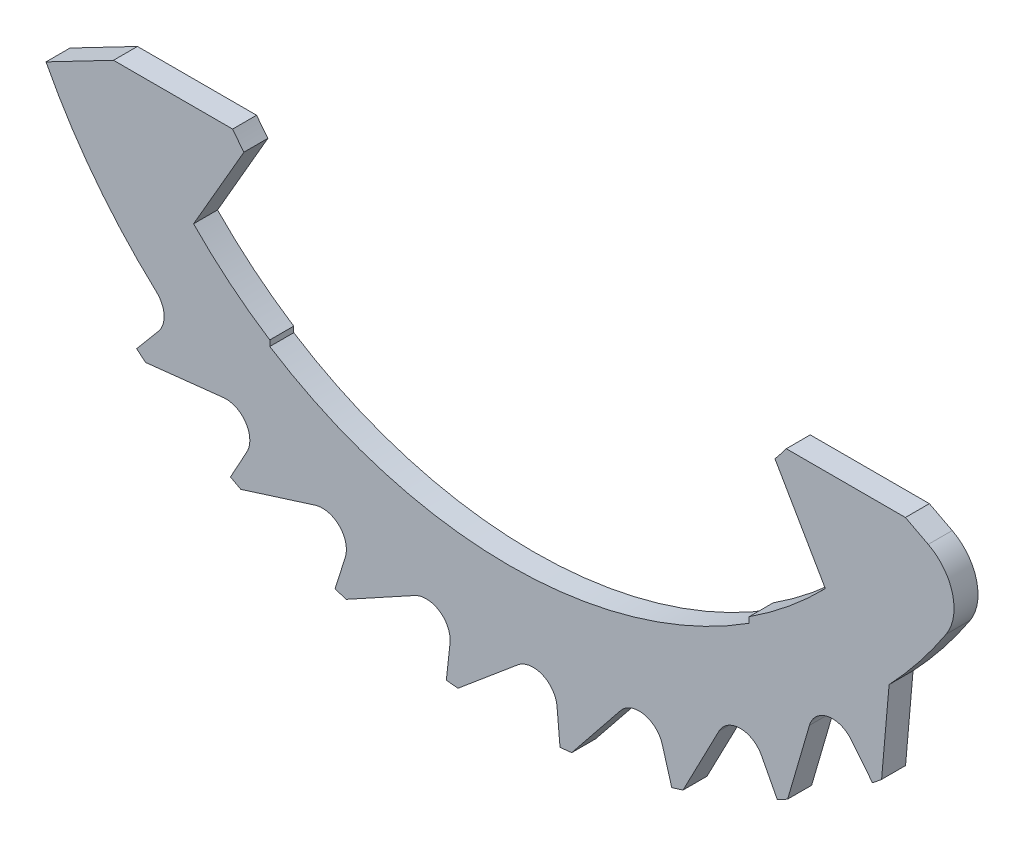
from build123d import *

# Parameters (mm, degrees)
OTHER_10076_5_DEPTH = 0.5
CUT_EXTRUDE1_START  = -0.5
CUT_EXTRUDE1_DEPTH  = 0.5


# Read off the part's stored shape, not the designer's step: 10076-5
with BuildPart() as part:
    # Other 10076-5 outline → Other 10076-5 (new body)
    with BuildSketch(Plane.XY):
        with BuildLine():
            ThreePointArc((7.573674013, -9.436602245), (7.668819519, -9.359444812), (7.763179028, -9.281328104))
            Line((7.763179028, -9.281328104), (7.919995926, -7.488902759))
            ThreePointArc((7.919995926, -7.488902759), (8.548470738, -6.76266575), (9.110578105, -5.983925684))
            ThreePointArc((9.110578105, -5.983925684), (9.242448569, -5.182849851), (8.736493865, -4.547930843))
            Line((8.736493865, -4.547930843), (8.260223146, -4.3))
            Line((8.260223146, -4.3), (5.774945887, -4.3))
            ThreePointArc((5.774945887, -4.3), (5.659072475, -4.451392897), (5.53923133, -4.5996648))
            Line((5.53923133, -4.5996648), (6.59, -6.419649523))
            ThreePointArc((6.59, -6.419649523), (5.831509763, -7.1157216), (5, -7.722693831))
            Line((5, -7.722693831), (5, -7.841555968))
            ThreePointArc((5, -7.841555968), (0, -9.3), (-5, -7.841555968))
            Line((-5, -7.841555968), (-5, -7.722693831))
            ThreePointArc((-5, -7.722693831), (-5.831509763, -7.1157216), (-6.59, -6.419649523))
            Line((-6.59, -6.419649523), (-5.53923133, -4.5996648))
            ThreePointArc((-5.53923133, -4.5996648), (-5.659072475, -4.451392897), (-5.774945887, -4.3))
            Line((-5.774945887, -4.3), (-8.260223146, -4.3))
            Line((-8.260223146, -4.3), (-10.732831081, -5.58715822))
            ThreePointArc((-10.732831081, -5.58715822), (-10.675718173, -5.6955282), (-10.617511084, -5.803314431))
            Line((-10.617511084, -5.803314431), (-9.055174855, -6.258693914))
            ThreePointArc((-9.055174855, -6.258693914), (-8.704696722, -6.64117368), (-8.882127626, -7.128661083))
            Line((-8.882127626, -7.128661083), (-9.436602245, -7.573674013))
            ThreePointArc((-9.436602245, -7.573674013), (-9.359444812, -7.668819519), (-9.281328104, -7.763179028))
            Line((-9.281328104, -7.763179028), (-7.660171598, -7.905011844))
            ThreePointArc((-7.660171598, -7.905011844), (-7.241809703, -8.211767477), (-7.320727248, -8.724502998))
            Line((-7.320727248, -8.724502998), (-7.777730077, -9.269137762))
            ThreePointArc((-7.777730077, -9.269137762), (-7.683493234, -9.347402405), (-7.588468891, -9.424709008))
            Line((-7.588468891, -9.424709008), (-5.970792243, -9.247544602))
            ThreePointArc((-5.970792243, -9.247544602), (-5.500623999, -9.466787654), (-5.477995427, -9.985067155))
            Line((-5.477995427, -9.985067155), (-5.819964104, -10.608393744))
            ThreePointArc((-5.819964104, -10.608393744), (-5.712269322, -10.666769858), (-5.603989074, -10.724052707))
            Line((-5.603989074, -10.724052707), (-4.05195869, -10.234699407))
            ThreePointArc((-4.05195869, -10.234699407), (-3.548052399, -10.358004491), (-3.424747314, -10.861910782))
            Line((-3.424747314, -10.861910782), (-3.638540174, -11.539975104))
            ThreePointArc((-3.638540174, -11.539975104), (-3.521526102, -11.576219327), (-3.404151099, -11.611277074))
            Line((-3.404151099, -11.611277074), (-1.977410637, -10.828540453))
            ThreePointArc((-1.977410637, -10.828540453), (-1.459131136, -10.851169025), (-1.239888083, -11.321337268))
            Line((-1.239888083, -11.321337268), (-1.317289186, -12.028081692))
            ThreePointArc((-1.317289186, -12.028081692), (-1.195452609, -12.04080118), (-1.073493507, -12.052286575))
            Line((-1.073493507, -12.052286575), (0.173128198, -11.006246762))
            ThreePointArc((0.173128198, -11.006246762), (0.685863719, -10.927329218), (0.992619352, -11.345691113))
            Line((0.992619352, -11.345691113), (1.054584487, -12.053955847))
            ThreePointArc((1.054584487, -12.053955847), (1.176561457, -12.042661796), (1.298417839, -12.030133462))
            Line((1.298417839, -12.030133462), (2.317013814, -10.760989181))
            ThreePointArc((2.317013814, -10.760989181), (2.804501216, -10.583558277), (3.186980982, -10.93403641))
            Line((3.186980982, -10.93403641), (3.38593107, -11.616603238))
            ThreePointArc((3.38593107, -11.616603238), (3.503360927, -11.581729673), (3.620431715, -11.545669067))
            Line((3.620431715, -11.545669067), (4.371857887, -10.10219282))
            ThreePointArc((4.371857887, -10.10219282), (4.815363304, -9.833067127), (5.258868721, -10.10219282))
            Line((5.258868721, -10.10219282), (5.58715822, -10.732831081))
            ThreePointArc((5.58715822, -10.732831081), (5.6955282, -10.675718173), (5.803314431, -10.617511084))
            Line((5.803314431, -10.617511084), (6.258693914, -9.055174855))
            ThreePointArc((6.258693914, -9.055174855), (6.64117368, -8.704696722), (7.128661083, -8.882127626))
            Line((7.128661083, -8.882127626), (7.573674013, -9.436602245))
        make_face()
    extrude(amount=OTHER_10076_5_DEPTH)

    # Sketch1 → Cut-Extrude1 (cut)
    with BuildSketch(Plane.XY.offset(0.5).offset(CUT_EXTRUDE1_START)):
        with BuildLine():
            Line((-9.668418082, -5.033059884), (-10.732831081, -5.58715822))
            ThreePointArc((-10.732831081, -5.58715822), (-10.066052286, -6.714506042), (-9.281328104, -7.763179028))
            Line((-9.281328104, -7.763179028), (-7.660171598, -7.905011844))
            ThreePointArc((-7.660171598, -7.905011844), (-7.502321095, -7.945477671), (-7.365865721, -8.034551772))
            ThreePointArc((-7.365865721, -8.034551772), (-8.648349239, -6.634459695), (-9.668418082, -5.033059884))
        make_face()
    extrude(amount=CUT_EXTRUDE1_DEPTH, mode=Mode.SUBTRACT)


solid = part.part
